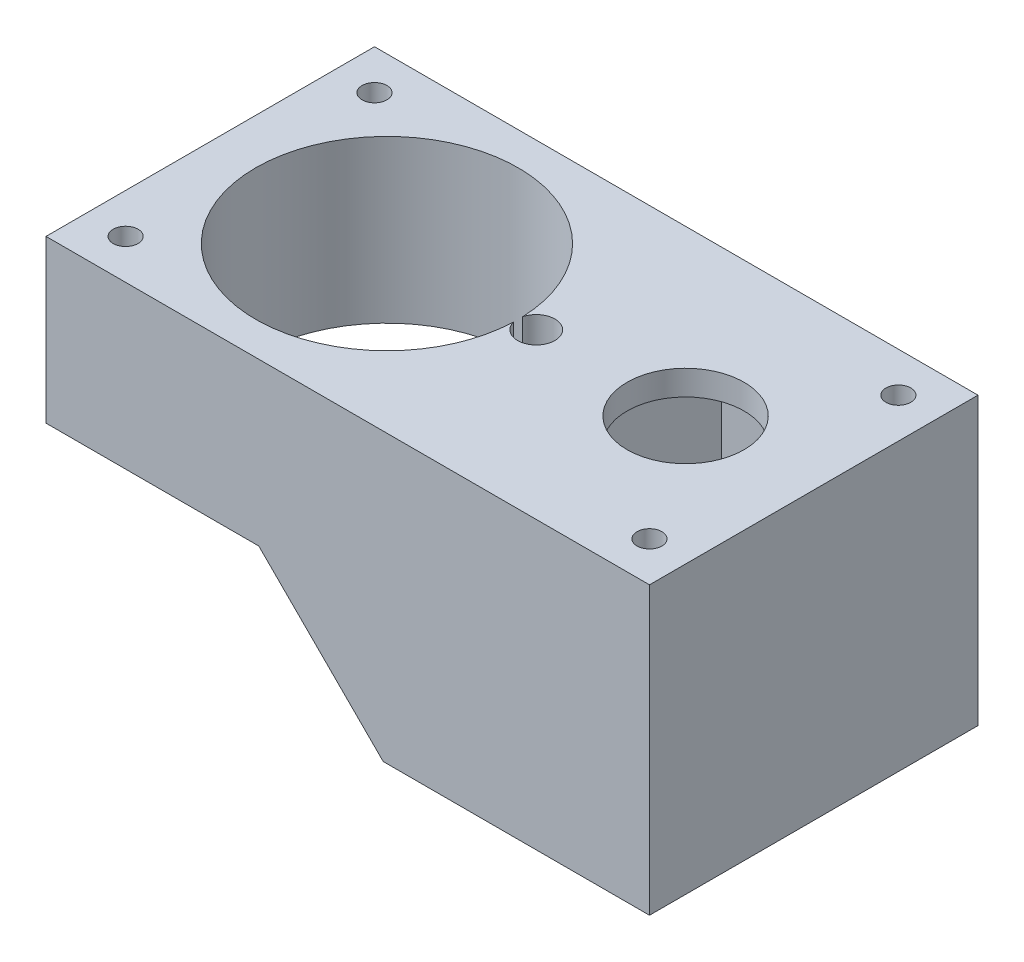
from build123d import *

# Parameters (mm, degrees)
ESQUISSE2_W             = 24.25
ESQUISSE2_H             = 13.2
ESQUISSE2_R             = 0.5
BOSS_EXTRU_1_DEPTH      = 10.5
ESQUISSE3_W             = 24.25
ESQUISSE3_H             = 13.2
ESQUISSE3_R             = 0.5
ESQUISSE3_R_2           = 2.35
BOSS_EXTRU_2_DEPTH      = 1
ESQUISSE4_W             = 13.55
ESQUISSE4_H             = 5
ENL_V_MAT_EXTRU_1_DEPTH = 30.024343231
CHANFREIN1_SIZE         = 5
BOSS_EXTRU_3_START      = 5.5
BOSS_EXTRU_3_DEPTH      = 5.5
ESQUISSE6_R             = 0.75
ENL_V_MAT_EXTRU_2_DEPTH = 29.540891717
CHANFREIN2_SIZE         = 0.5


with BuildPart() as part:
    # Esquisse2 → Boss.-Extru.1 (new body)
    with BuildSketch(Plane(origin=(0, 0, 0), x_dir=(1, 0, 0), z_dir=(0, 1, 0))):
        with Locations((11.025, 5.5)):
            Rectangle(ESQUISSE2_W, ESQUISSE2_H)
        Polygon((0, 8.5), (2.5, 11), (12.45, 11), (12.45, 0), (2.5, 0), (0, 2.5), align=None, mode=Mode.SUBTRACT)
        with Locations(Location((0.5, 10.5, 0), (0, 0, 270))):
            Circle(ESQUISSE2_R, mode=Mode.SUBTRACT)
        Polygon((19.55, 0), (13.95, 0), (13.95, 11), (19.55, 11), (22.05, 8.5), (22.05, 2.5), align=None, mode=Mode.SUBTRACT)
        with Locations(Location((0.5, 0.5, 0), (0, 0, 270))):
            Circle(ESQUISSE2_R, mode=Mode.SUBTRACT)
        with Locations(Location((21.55, 0.5, 0), (0, 0, 270))):
            Circle(ESQUISSE2_R, mode=Mode.SUBTRACT)
        with Locations(Location((21.55, 10.5, 0), (0, 0, 270))):
            Circle(ESQUISSE2_R, mode=Mode.SUBTRACT)
    extrude(amount=BOSS_EXTRU_1_DEPTH)

    # Esquisse3 → Boss.-Extru.2 (add)
    with BuildSketch(Plane(origin=(0, 10.5, 0), x_dir=(1, 0, 0), z_dir=(0, 1, 0))):
        with Locations((11.025, 5.5)):
            Rectangle(ESQUISSE3_W, ESQUISSE3_H)
        with Locations(Location((0.5, 0.5, 0), (0, 0, 270))):
            Circle(ESQUISSE3_R, mode=Mode.SUBTRACT)
        with Locations(Location((21.55, 0.5, 0), (0, 0, 270))):
            Circle(ESQUISSE3_R, mode=Mode.SUBTRACT)
        with BuildLine():
            ThreePointArc((11.271927083, 5.319972702), (0.725, 5.5), (11.271927083, 5.680027298))
            ThreePointArc((11.271927083, 5.680027298), (12.090678863, 6.244498048), (12.75, 5.5))
            ThreePointArc((12.75, 5.5), (12.090678863, 4.755501952), (11.271927083, 5.319972702))
        make_face(mode=Mode.SUBTRACT)
        with Locations(Location((0.5, 10.5, 0), (0, 0, 270))):
            Circle(ESQUISSE3_R, mode=Mode.SUBTRACT)
        with Locations(Location((18, 5.5, 0), (0, 0, 270))):
            Circle(ESQUISSE3_R_2, mode=Mode.SUBTRACT)
        with Locations(Location((21.55, 10.5, 0), (0, 0, 270))):
            Circle(ESQUISSE3_R, mode=Mode.SUBTRACT)
    extrude(amount=BOSS_EXTRU_2_DEPTH)

    # Esquisse4 → Enlèv. mat.-Extru.1 (cut, through all)
    with BuildSketch(Plane.XY.offset(1.1)):
        with Locations((5.675, 2.5)):
            Rectangle(ESQUISSE4_W, ESQUISSE4_H)
    extrude(amount=-ENL_V_MAT_EXTRU_1_DEPTH, mode=Mode.SUBTRACT)

    # Chanfrein1
    chanfrein1_edges = [part.edges().sort_by_distance(p)[0] for p in [
        (12.45, 5, -11.55),
        (12.45, 5, 0.55),
    ]]
    chamfer(chanfrein1_edges, length=CHANFREIN1_SIZE - 0.0001)  # a hair under: the kernel refuses the full size

    # Esquisse5 → Boss.-Extru.3 (add)
    with BuildSketch(Plane.XZ.offset(-10.5).offset(BOSS_EXTRU_3_START)):
        with BuildLine():
            ThreePointArc((11.79984375, -6.936118893), (13.45, -5.5), (11.79984375, -4.063881107))
            ThreePointArc((11.79984375, -4.063881107), (0.025, -5.5), (11.79984375, -6.936118893))
        make_face()
        with BuildLine():
            ThreePointArc((11.271927083, -5.319972702), (0.725, -5.5), (11.271927083, -5.680027298))
            ThreePointArc((11.271927083, -5.680027298), (12.75, -5.5), (11.271927083, -5.319972702))
        make_face(mode=Mode.SUBTRACT)
    extrude(amount=-BOSS_EXTRU_3_DEPTH)

    # Esquisse6 → Enlèv. mat.-Extru.2 (cut, through all)
    with BuildSketch(Plane(origin=(0, 11.5, 0), x_dir=(1, 0, 0), z_dir=(0, 1, 0))):
        with Locations((12, 5.5)):
            Circle(ESQUISSE6_R)
    extrude(amount=-ENL_V_MAT_EXTRU_2_DEPTH, mode=Mode.SUBTRACT)

    # Chanfrein2
    chanfrein2_edges = [part.edges().sort_by_distance(p)[0] for p in [
        (0.5, 5, -1),
        (0.5, 5, -11),
        (21.55, 0, -1),
        (21.55, 0, -11),
    ]]
    chamfer(chanfrein2_edges, length=CHANFREIN2_SIZE)


solid = part.part
